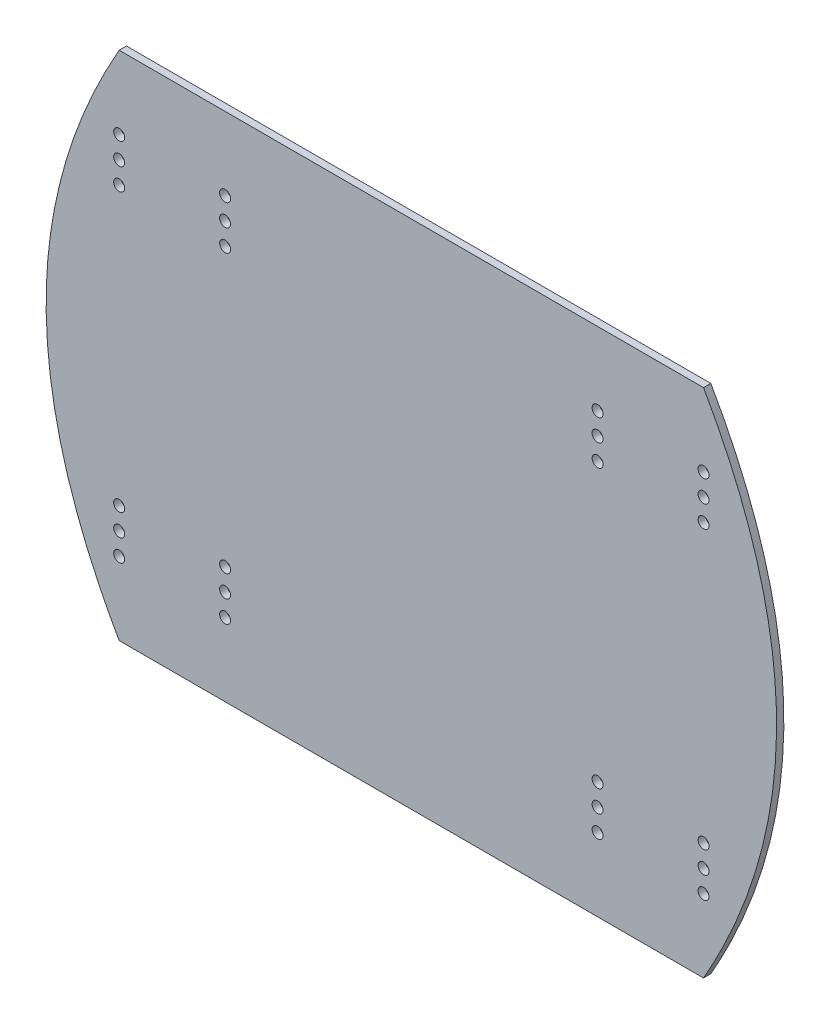
from build123d import *

# Parameters (mm, degrees)
SKETCH3_W               = 200
SKETCH3_H               = 140
BOSS_EXTRUDE1_DEPTH     = 2
SKETCH7_R               = 1.5
CUT_EXTRUDE1_DEPTH      = 123.081939696
SKETCH8_R               = 1.5
CUT_EXTRUDE2_DEPTH      = 123.081939696
CUT_EXTRUDE5_START      = -2
CUT_EXTRUDE5_DEPTH      = 2
CUT_EXTRUDE6_DEPTH      = 123.081939837
CUT_EXTRUDE6_DEPTH_BACK = 123.081939837


# Read off the part's stored shape, not the designer's step: Cut-Extrude5
with BuildPart() as part:
    # Sketch3 → Boss-Extrude1 (new body)
    with BuildSketch(Plane.XY):
        Rectangle(SKETCH3_W, SKETCH3_H)
    extrude(amount=BOSS_EXTRUDE1_DEPTH)

    # Sketch7 → Cut-Extrude1 (cut, through all)
    with BuildSketch(Plane.XY.offset(2)):
        with Locations((-80, -44)):
            Circle(SKETCH7_R)
        with Locations((-51, -50)):
            Circle(SKETCH7_R)
        with Locations((-51, -38)):
            Circle(SKETCH7_R)
        with Locations((-51, -44)):
            Circle(SKETCH7_R)
        with Locations((-80, -50)):
            Circle(SKETCH7_R)
        with Locations((-80, -38)):
            Circle(SKETCH7_R)
    extrude(amount=-CUT_EXTRUDE1_DEPTH, mode=Mode.SUBTRACT)

    # Sketch8 → Cut-Extrude2 (cut, through all)
    with BuildSketch(Plane.XY.offset(2)):
        with Locations((-80, 50.001919615)):
            Circle(SKETCH8_R)
        with Locations((-80, 44.001919615)):
            Circle(SKETCH8_R)
        with Locations((-80, 38.001919615)):
            Circle(SKETCH8_R)
        with Locations((-51, 50.001919615)):
            Circle(SKETCH8_R)
        with Locations((-51, 44.001919615)):
            Circle(SKETCH8_R)
        with Locations((-51, 38.001919615)):
            Circle(SKETCH8_R)
        with Locations((80, 50.001919615)):
            Circle(SKETCH8_R)
        with Locations((80, 44.001919615)):
            Circle(SKETCH8_R)
        with Locations((80, 38.001919615)):
            Circle(SKETCH8_R)
        with Locations((51, 50.001919615)):
            Circle(SKETCH8_R)
        with Locations((51, 44.001919615)):
            Circle(SKETCH8_R)
        with Locations((51, 38.001919615)):
            Circle(SKETCH8_R)
        with Locations((51, -38)):
            Circle(SKETCH8_R)
        with Locations((51, -44)):
            Circle(SKETCH8_R)
        with Locations((51, -50)):
            Circle(SKETCH8_R)
        with Locations((80, -38)):
            Circle(SKETCH8_R)
        with Locations((80, -44)):
            Circle(SKETCH8_R)
        with Locations((80, -50)):
            Circle(SKETCH8_R)
    extrude(amount=-CUT_EXTRUDE2_DEPTH, mode=Mode.SUBTRACT)

    # Cut-Extrude5 outline → Cut-Extrude5 (cut)
    with BuildSketch(Plane.XY.offset(2).offset(CUT_EXTRUDE5_START)):
        with BuildLine():
            add(Edge.make_bspline(
                [(-100, 0), (-100, -35), (-80, -70)],
                knots=[0.5, 0.5, 0.5, 1, 1, 1], degree=2))
            Line((-100, 0), (-100, -70))
            Line((-100, -70), (-80, -70))
        make_face()
        with BuildLine():
            add(Edge.make_bspline(
                [(-80, 70), (-100, 35), (-100, 0)],
                knots=[0, 0, 0, 0.5, 0.5, 0.5], degree=2))
            Line((-80, 70), (-100, 70))
            Line((-100, 70), (-100, 0))
        make_face()
    extrude(amount=CUT_EXTRUDE5_DEPTH, mode=Mode.SUBTRACT)

    # Sketch16 → Cut-Extrude6 (cut, two sides: drawn at the far end of the back side and taken through both)
    with BuildSketch(Plane.XY.offset(2).offset(-CUT_EXTRUDE6_DEPTH_BACK)):
        with BuildLine():
            Line((100, 70), (80, 70))
            add(Edge.make_bspline(
                [(80, 70), (100.000000027, 34.999999953), (100, -9.3e-08)],
                knots=[0, 0, 0, 0.500000001, 0.500000001, 0.500000001], degree=2))
            Line((100, -9.3e-08), (100, 70))
        make_face()
        with BuildLine():
            Line((100, -70), (100, -9.3e-08))
            add(Edge.make_bspline(
                [(100, -9.3e-08), (99.999999973, -35.000000047), (80, -70)],
                knots=[0.500000001, 0.500000001, 0.500000001, 1, 1, 1], degree=2))
            Line((80, -70), (100, -70))
        make_face()
    extrude(amount=CUT_EXTRUDE6_DEPTH + CUT_EXTRUDE6_DEPTH_BACK, mode=Mode.SUBTRACT)


solid = part.part
